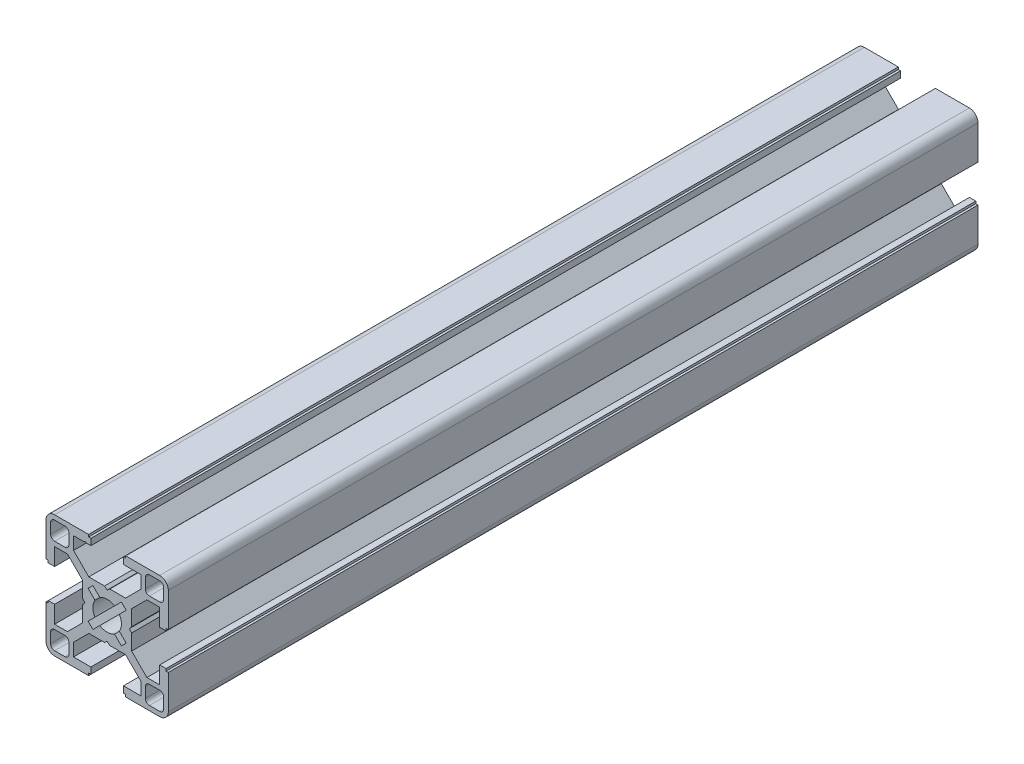
from build123d import *

# Parameters (mm, degrees)
BOSS_EXTRUDE1_DEPTH     = 198.6
CUT_EXTRUDE1_DEPTH      = 200.729717368
CUT_EXTRUDE1_DEPTH_BACK = 200.729717368


with BuildPart() as part:
    # Sketch4 → Boss-Extrude1 (new body)
    with BuildSketch(Plane.XY):
        with BuildLine():
            Line((0, -5.45), (0.655464476, -6))
            Line((0.655464476, -6), (4.504469158, -6))
            Line((4.504469158, -6), (8.25, -9.745530842))
            Line((8.25, -9.745530842), (8.25, -12.885))
            Line((8.25, -12.885), (4, -12.885))
            Line((4, -12.885), (4, -14.45))
            Line((4, -14.45), (4.55, -14.45))
            Line((4.55, -14.45), (4.55, -15))
            Line((4.55, -15), (12.885, -15))
            ThreePointArc((12.885, -15), (14.380530842, -14.380530842), (15, -12.885))
            Line((15, -12.885), (15, -4.55))
            Line((15, -4.55), (14.45, -4.55))
            Line((14.45, -4.55), (14.45, -4))
            Line((14.45, -4), (12.885, -4))
            Line((12.885, -4), (12.885, -8.25))
            Line((12.885, -8.25), (9.745530842, -8.25))
            Line((9.745530842, -8.25), (6, -4.504469158))
            Line((6, -4.504469158), (6, -0.655464476))
            Line((6, -0.655464476), (5.45, 0))
            Line((5.45, 0), (3.5, 0))
            ThreePointArc((3.5, 0), (3.371433308, -0.939913534), (2.995178599, -1.81077474))
            Line((2.995178599, -1.81077474), (4.675743591, -3.491339732))
            Line((4.675743591, -3.491339732), (3.491339732, -4.675743591))
            Line((3.491339732, -4.675743591), (1.81077474, -2.995178599))
            ThreePointArc((1.81077474, -2.995178599), (0.939913534, -3.371433308), (0, -3.5))
            Line((0, -3.5), (0, -5.45))
        make_face()
        with BuildLine():
            Line((9.375, -10.365), (9.375, -12.885))
            ThreePointArc((9.375, -12.885), (9.664964287, -13.585035713), (10.365, -13.875))
            Line((10.365, -13.875), (12.885, -13.875))
            ThreePointArc((12.885, -13.875), (13.585035713, -13.585035713), (13.875, -12.885))
            Line((13.875, -12.885), (13.875, -10.365))
            ThreePointArc((13.875, -10.365), (13.585035713, -9.664964287), (12.885, -9.375))
            Line((12.885, -9.375), (10.365, -9.375))
            ThreePointArc((10.365, -9.375), (9.664964287, -9.664964287), (9.375, -10.365))
        make_face(mode=Mode.SUBTRACT)
    extrude(amount=BOSS_EXTRUDE1_DEPTH)

    # Mirror1: part across plane


with BuildPart() as part_1:
    add(part.part)
    add(part.part.mirror(Plane(origin=(0, 0, 0), x_dir=(0, 0, 1), z_dir=(1, 0, 0))))

    # Mirror2: part across plane


with BuildPart() as part_2:
    add(part_1.part)
    add(part_1.part.mirror(Plane.ZX))

    # Sketch5 → Cut-Extrude1 (cut, two sides: drawn at the far end of the back side and taken through both)
    with BuildSketch(Plane.XY.offset(198.6).offset(-CUT_EXTRUDE1_DEPTH_BACK)):
        Polygon((-5.675, 12.885), (-5.4, 13.16), (-5.125, 12.885), align=None)
    extrude(amount=CUT_EXTRUDE1_DEPTH + CUT_EXTRUDE1_DEPTH_BACK, mode=Mode.SUBTRACT)


solid = part_2.part
